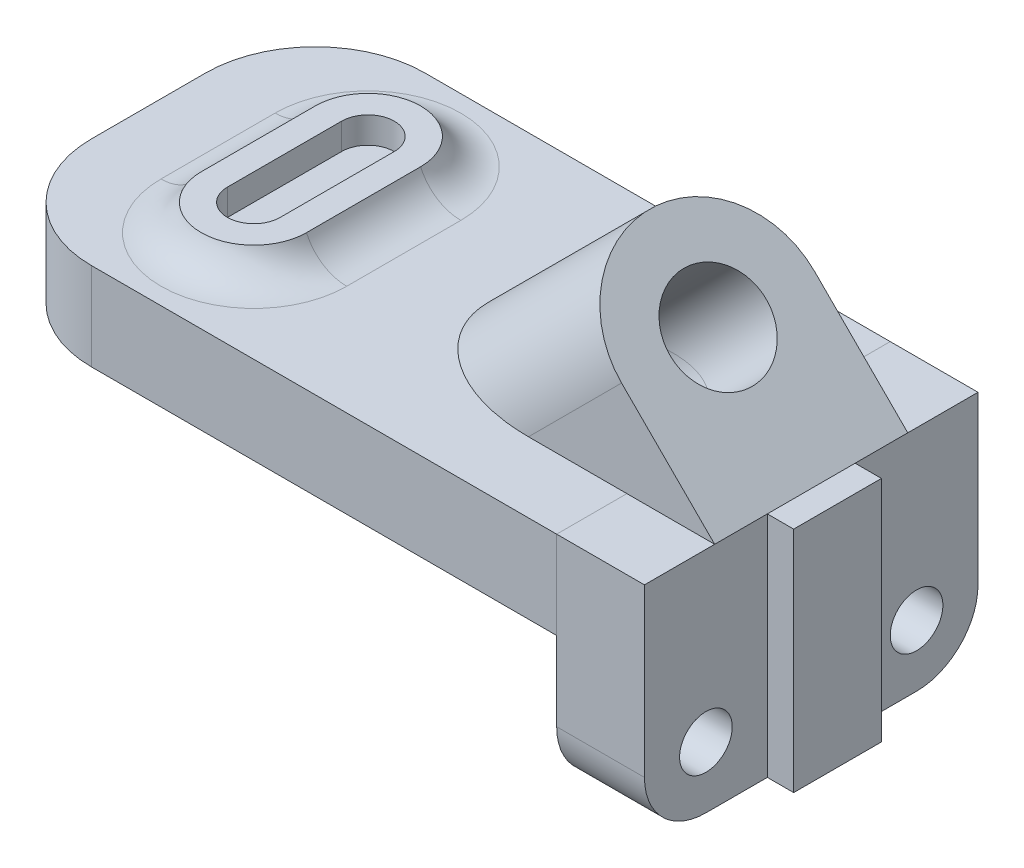
from build123d import *

# Parameters (mm, degrees)
BOSS_EXTRUDE1_DEPTH = 20
BOSS_EXTRUDE2_DEPTH = 6
FILLET1_R           = 10
SKETCH3_W           = 20
SKETCH3_H           = 52
BOSS_EXTRUDE3_DEPTH = 76
FILLET2_R           = 14
SKETCH4_W           = 20
SKETCH4_H           = 52
BOSS_EXTRUDE4_DEPTH = 6
BOSS_EXTRUDE5_REACH = 156.071
SKETCH4_3_R         = 6
CUT_EXTRUDE1_DEPTH  = 20
SKETCH4_4_R         = 6
CUT_EXTRUDE2_DEPTH  = 20


with BuildPart() as part:
    # Sketch1 → Boss-Extrude1 (new body)
    with BuildSketch(Plane(origin=(0, 0, 0), x_dir=(1, 0, 0), z_dir=(0, 1, 0))):
        with BuildLine():
            Line((-70.022961628, 1.904377184), (-70.022961628, -24.095622816))
            ThreePointArc((-70.022961628, -24.095622816), (-62.700631157, -41.773292346), (-45.022961628, -49.095622816))
            Line((-45.022961628, -49.095622816), (60.977038372, -49.095622816))
            Line((60.977038372, -49.095622816), (60.977038372, 26.904377184))
            Line((60.977038372, 26.904377184), (-45.022961628, 26.904377184))
            ThreePointArc((-45.022961628, 26.904377184), (-62.700631157, 19.582046714), (-70.022961628, 1.904377184))
        make_face()
    extrude(amount=BOSS_EXTRUDE1_DEPTH)

    # Sketch2 → Boss-Extrude2 (add)
    with BuildSketch(Plane(origin=(0, 20, 0), x_dir=(1, 0, 0), z_dir=(0, 1, 0))):
        with BuildLine():
            Line((-45.022961628, 1.904377184), (-45.022961628, -24.095622816))
            ThreePointArc((-45.022961628, -24.095622816), (-33.022961628, -36.095622816), (-21.022961628, -24.095622816))
            Line((-21.022961628, -24.095622816), (-21.022961628, 1.904377184))
            ThreePointArc((-21.022961628, 1.904377184), (-33.022961628, 13.904377184), (-45.022961628, 1.904377184))
        make_face()
        with BuildLine():
            ThreePointArc((-39.022961628, -24.095622816), (-33.022961628, -30.095622816), (-27.022961628, -24.095622816))
            Line((-27.022961628, -24.095622816), (-27.022961628, 1.904377184))
            ThreePointArc((-27.022961628, 1.904377184), (-33.022961628, 7.904377184), (-39.022961628, 1.904377184))
            Line((-39.022961628, 1.904377184), (-39.022961628, -24.095622816))
        make_face(mode=Mode.SUBTRACT)
    extrude(amount=BOSS_EXTRUDE2_DEPTH)

    # Fillet1
    # the kernel refuses this fillet: 10 mm, written as the material it adds along each edge
    with BuildSketch(Plane(origin=(-33.022961628, 20, -1.904377184), x_dir=(1, 0, 0), z_dir=(0, 0, 1))) as fillet1_piece_1:
        with BuildLine():
            CenterArc((21.16515139, 10), FILLET1_R, 203.578178478, 66.421821522)
            Line((12, 6), (11.816696972, 5.92))
            ThreePointArc((11.816696972, 5.92), (11.8, 3), (11.8, 0))
            Line((11.8, 0), (12, -0.2))
            Line((12, -0.2), (21.16515139, -0.2))
            Line((21.16515139, -0.2), (21.16515139, 0))
        make_face()
    revolve(axis=Axis((-33.022961628, 20, -1.904377184), (0, 1, 0)), revolution_arc=180)
    with BuildSketch(Plane(origin=(-45.022961628, 20, -1.904377184), x_dir=(-1, 0, 0), z_dir=(0, 0, 1)), Plane(origin=(-21.022961628, 20, 24.095622816), x_dir=(1, 0, 0), z_dir=(0, 0, -1))) as fillet1_piece_2:
        with BuildLine():
            CenterArc((9.16515139, -10), FILLET1_R, 90, 66.421821522)
            Line((0, -6), (-0.183303028, -5.92))
            ThreePointArc((-0.183303028, -5.92), (-0.2, -3), (-0.2, 0))
            Line((-0.2, 0), (0, 0.2))
            Line((0, 0.2), (9.16515139, 0.2))
            Line((9.16515139, 0.2), (9.16515139, 0))
        make_face()
    extrude(amount=26)
    with BuildSketch(Plane(origin=(-33.022961628, 20, 24.095622816), x_dir=(-1, 0, 0), z_dir=(0, 0, -1))) as fillet1_piece_3:
        with BuildLine():
            CenterArc((21.16515139, 10), FILLET1_R, 203.578178478, 66.421821522)
            Line((12, 6), (11.816696972, 5.92))
            ThreePointArc((11.816696972, 5.92), (11.8, 3), (11.8, 0))
            Line((11.8, 0), (12, -0.2))
            Line((12, -0.2), (21.16515139, -0.2))
            Line((21.16515139, -0.2), (21.16515139, 0))
        make_face()
    revolve(axis=Axis((-33.022961628, 20, 24.095622816), (0, 1, 0)), revolution_arc=180)


with BuildPart() as body_2:
    # Sketch3 → Boss-Extrude3 (new body)
    with BuildSketch(Plane.XY.offset(49.095622816)):
        with Locations((70.977038372, -6)):
            Rectangle(SKETCH3_W, SKETCH3_H)
    extrude(amount=-BOSS_EXTRUDE3_DEPTH)

    # Fillet2
    fillet2_edges = [body_2.edges().sort_by_distance(p)[0] for p in [
        (70.977038372, -32, 49.095622816),
        (70.977038372, -32, -26.904377184),
    ]]
    fillet(fillet2_edges, radius=FILLET2_R)

    # Sketch4 → Boss-Extrude4 (add)
    with BuildSketch(Plane(origin=(80.977038372, 0, 0), x_dir=(0, 0, -1), z_dir=(1, 0, 0))):
        with Locations((-11.095622816, -6)):
            Rectangle(SKETCH4_W, SKETCH4_H)
    extrude(amount=BOSS_EXTRUDE4_DEPTH)

    # Sketch4<3> → Cut-Extrude1 (cut)
    with BuildSketch(Plane(origin=(80.977038372, 0, 0), x_dir=(0, 0, -1), z_dir=(1, 0, 0))):
        with Locations((-35.095622816, -18)):
            Circle(SKETCH4_3_R)
    extrude(amount=-CUT_EXTRUDE1_DEPTH, mode=Mode.SUBTRACT)

    # Sketch4<4> → Cut-Extrude2 (cut)
    with BuildSketch(Plane(origin=(80.977038372, 0, 0), x_dir=(0, 0, -1), z_dir=(1, 0, 0))):
        with Locations((12.904377184, -18)):
            Circle(SKETCH4_4_R)
    extrude(amount=-CUT_EXTRUDE2_DEPTH, mode=Mode.SUBTRACT)


with BuildPart() as body_3:

    # Boss-Extrude5: up to this face of the body (flat: up to its plane)
    boss_extrude5_end = Plane(part.part.faces().sort_by_distance((-33.022961628, 20, 11.095622816))[0])
    # Sketch5 → Boss-Extrude5 (new, up to the picked face)
    with BuildSketch(Plane(origin=(50.488519186, 50.488519186, 0), x_dir=(0.7071067811865464, -0.7071067811865488, 0), z_dir=(0.7071067811865488, 0.7071067811865464, 0)), mode=Mode.PRIVATE) as boss_extrude5_sk1:
        with BuildLine():
            Line((43.11727733, -33.095622816), (13.11727733, -33.095622816))
            ThreePointArc((13.11727733, -33.095622816), (-8.88272267, -11.095622816), (13.11727733, 10.904377184))
            Line((13.11727733, 10.904377184), (43.11727733, 10.904377184))
            Line((43.11727733, 10.904377184), (43.11727733, -33.095622816))
        make_face()
    boss_extrude5_tool1 = split(extrude(boss_extrude5_sk1.sketch, amount=-BOSS_EXTRUDE5_REACH, mode=Mode.PRIVATE), bisect_by=boss_extrude5_end, keep=Keep.BOTH, mode=Mode.PRIVATE)
    add(boss_extrude5_tool1.solids().sort_by(Axis((64.081168, 36.89587, 11.095623), (-0.7071067811865488, -0.7071067811865464, 0)))[0])


with BuildPart() as f_20_0mm_dowel_hole1_tool:
    # Sketch8 → Ø20.0mm Dowel Hole1 (revolve)
    with BuildSketch(Plane(origin=(59.763834937, 41.213203436, 11.095622816), x_dir=(-0.7071067811865464, 0.7071067811865488, 0), z_dir=(0, 0, 1))):
        Polygon((0, 0), (0, 38.609466809), (11, 32), (11, 0), align=None)
    revolve(axis=Axis((64.253962997, 45.703331496, 11.095622816), (-0.7071067811865487, -0.7071067811865464, 0)))


with BuildPart() as part_1:
    add(part.part)

    # Ø20.0mm Dowel Hole1: cut by f_20_0mm_dowel_hole1_tool
    add(f_20_0mm_dowel_hole1_tool.part, mode=Mode.SUBTRACT)


with BuildPart() as body_3_1:
    add(body_3.part)

    # Ø20.0mm Dowel Hole1: cut by f_20_0mm_dowel_hole1_tool
    add(f_20_0mm_dowel_hole1_tool.part, mode=Mode.SUBTRACT)


solid = Compound([body_2.part, part_1.part, body_3_1.part])
